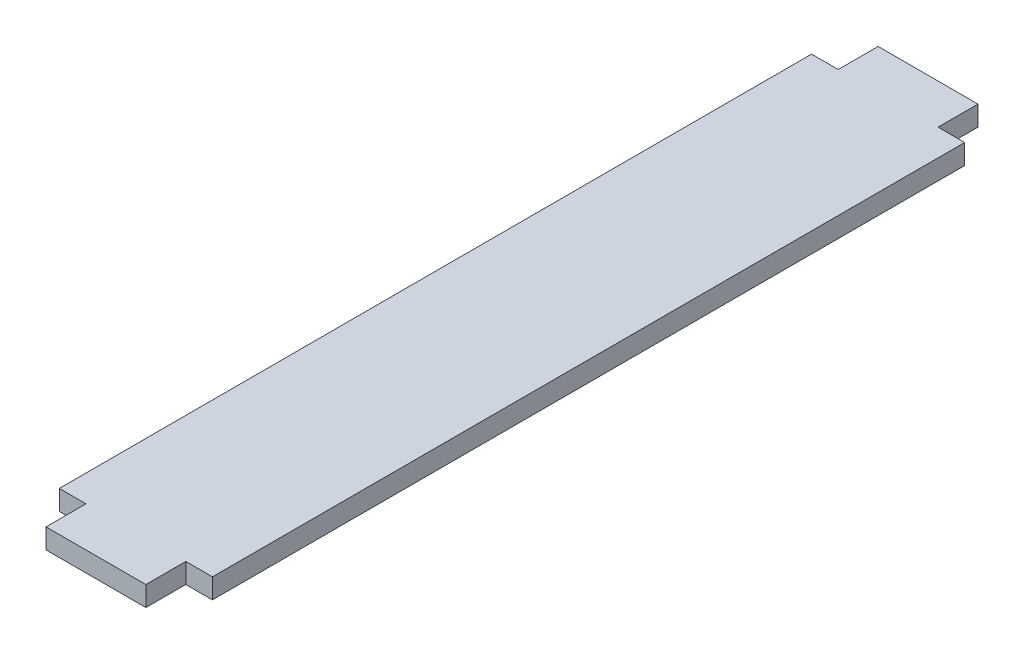
from build123d import *

# Parameters (mm, degrees)
BOSS_EXTRUDE1_DEPTH = 1.5


with BuildPart() as part:
    # Sketch1 → Boss-Extrude1 (new body)
    with BuildSketch(Plane(origin=(0, 0, 0), x_dir=(1, 0, 0), z_dir=(0, 1, 0))):
        Polygon((3.75, 28.25), (5.75, 28.25), (5.75, -11.65), (5.75, -13.35), (5.75, -28.25), (3.75, -28.25), (3.75, -31.25), (-3.75, -31.25), (-3.75, -28.25), (-5.75, -28.25), (-5.75, -18.35), (-5.75, -16.65), (-5.75, 28.25), (-3.75, 28.25), (-3.75, 31.25), (3.75, 31.25), align=None)
    extrude(amount=BOSS_EXTRUDE1_DEPTH)


solid = part.part
